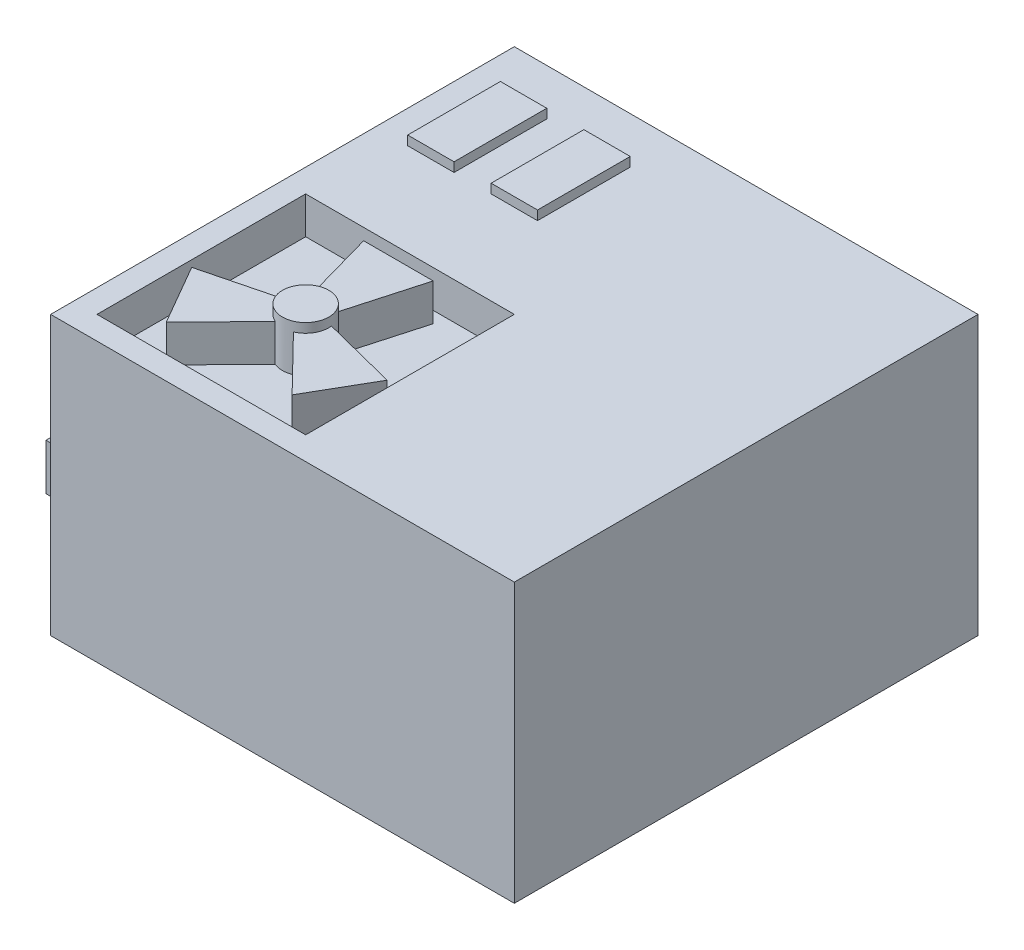
from build123d import *
from build123d.topology import SkipClean

# Parameters (mm, degrees)
SKETCH_1_W          = 100
SKETCH_1_H          = 100
EXTRUDE_1_DEPTH     = 60
SKETCH_2_W          = 45
SKETCH_2_H          = 45
CUT_EXTRUDE_1_DEPTH = 8
SKETCH_3_W          = 10
SKETCH_3_H          = 20
EXTRUDE_2_DEPTH     = 2
SKETCH_4_W          = 20
SKETCH_4_H          = 10
SKETCH_4_W_2        = 10
EXTRUDE_3_DEPTH     = 2
SKETCH_5_R          = 5
SKETCH_5_R_2        = 2.5
EXTRUDE_4_DEPTH     = 2
FILLET_1_R          = 1.25
FILLET_2_R          = 1.25
EXTRUDE_5_DEPTH     = 8
SKETCH_7_R          = 5
EXTRUDE_6_DEPTH     = 2


with BuildPart() as part:
    # 草图1 → 凸台-拉伸1 (new body)
    with BuildSketch(Plane(origin=(0, 0, 0), x_dir=(1, 0, 0), z_dir=(0, 1, 0))):
        Rectangle(SKETCH_1_W, SKETCH_1_H)
    extrude(amount=EXTRUDE_1_DEPTH)

    # 草图2 → 切除-拉伸1 (cut)
    with BuildSketch(Plane(origin=(0, 60, 0), x_dir=(1, 0, 0), z_dir=(0, 1, 0))):
        with Locations((-22.5, -22.5)):
            Rectangle(SKETCH_2_W, SKETCH_2_H)
    extrude(amount=-CUT_EXTRUDE_1_DEPTH, mode=Mode.SUBTRACT)

    # 草图3 → 凸台-拉伸2 (add)
    with BuildSketch(Plane(origin=(0, 60, 0), x_dir=(1, 0, 0), z_dir=(0, 1, 0))):
        with Locations((-38, 30)):
            Rectangle(SKETCH_3_W, SKETCH_3_H)
        with Locations((-20, 30)):
            Rectangle(SKETCH_3_W, SKETCH_3_H)
    extrude(amount=EXTRUDE_2_DEPTH)

    # 草图4 → 凸台-拉伸3 (add)
    with BuildSketch(Plane.ZY.offset(50)):
        with Locations((15, 25)):
            Rectangle(SKETCH_4_W, SKETCH_4_H)
        with Locations((44, 30)):
            Rectangle(SKETCH_4_W_2, SKETCH_4_H)
    extrude(amount=EXTRUDE_3_DEPTH)

    # 草图5 → 凸台-拉伸4 (add)
    # profile 1 of 2: a face of its own
    with BuildSketch(Plane.ZY.offset(50)):
        with Locations(Location((15, 47, 0), (0, 0, 180))):
            Circle(SKETCH_5_R)
        with Locations((15, 47)):
            Circle(SKETCH_5_R_2, mode=Mode.SUBTRACT)
    # profile 2 of 2: a face of its own
    with BuildSketch(Plane.ZY.offset(50)):
        with Locations(Location((35, 47, 0), (0, 0, 180))):
            Circle(SKETCH_5_R)
        with Locations((35, 47)):
            Circle(SKETCH_5_R_2, mode=Mode.SUBTRACT)
    extrude(amount=EXTRUDE_4_DEPTH)

    # 圆角1
    fillet_1_edges = [part.edges().sort_by_distance(p)[0] for p in [
        (-52, 47, 20),
        (-52, 47, 12.5),
    ]]
    fillet(fillet_1_edges, radius=FILLET_1_R - 0.0001)  # a hair under: the kernel refuses the full size

    # 圆角2
    fillet_2_edges = [part.edges().sort_by_distance(p)[0] for p in [
        (-52, 47, 40),
        (-52, 47, 32.5),
    ]]
    fillet(fillet_2_edges, radius=FILLET_2_R - 0.0001)  # a hair under: the kernel refuses the full size

    # 草图6 → 凸台-拉伸5 (add)
    with BuildSketch(Plane(origin=(0, 52, 0), x_dir=(1, 0, 0), z_dir=(0, 1, 0))):
        with BuildLine():
            Line((-25.5, -18.5), (-30, -2.5))
            Line((-30, -2.5), (-15, -2.5))
            Line((-15, -2.5), (-19.5, -18.5))
            ThreePointArc((-19.5, -18.5), (-18.169872981, -20), (-17.535898385, -21.901923789))
            Line((-17.535898385, -21.901923789), (-1.429491924, -26.004809472))
            Line((-1.429491924, -26.004809472), (-8.929491924, -38.995190528))
            Line((-8.929491924, -38.995190528), (-20.535898385, -27.098076211))
            ThreePointArc((-20.535898385, -27.098076211), (-22.5, -27.5), (-24.464101615, -27.098076211))
            Line((-24.464101615, -27.098076211), (-36.070508076, -38.995190528))
            Line((-36.070508076, -38.995190528), (-43.570508076, -26.004809472))
            Line((-43.570508076, -26.004809472), (-27.464101615, -21.901923789))
            ThreePointArc((-27.464101615, -21.901923789), (-26.830127019, -20), (-25.5, -18.5))
        make_face()
    extrude(amount=EXTRUDE_5_DEPTH)

    # 草图7 → 凸台-拉伸6 (add)
    with SkipClean():  # the faces are left unmerged after this step: merging them gives an invalid solid
        with BuildSketch(Plane(origin=(0, 60, 0), x_dir=(1, 0, 0), z_dir=(0, 1, 0))):
            with Locations(Location((-22.5, -22.5, 0), (0, 0, 53.130102354))):
                Circle(SKETCH_7_R)
        extrude(amount=EXTRUDE_6_DEPTH)


solid = part.part
